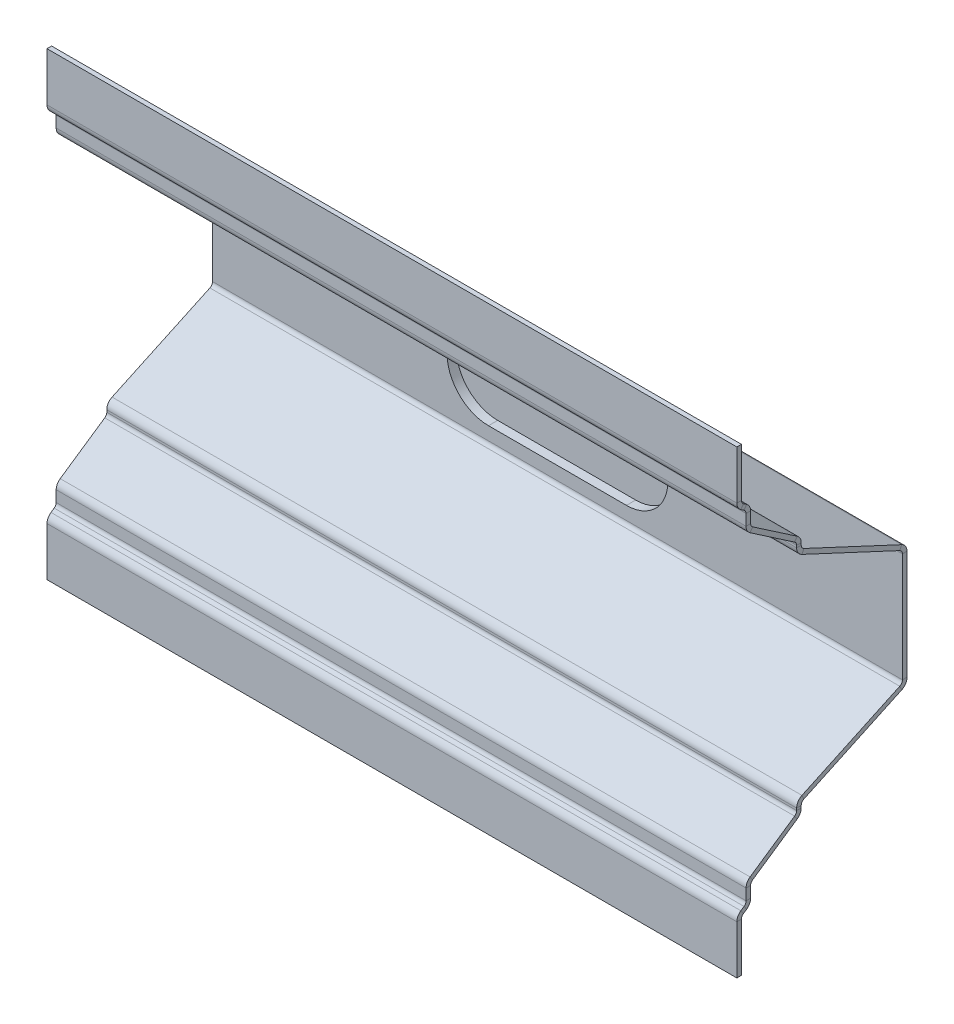
from build123d import *

# Parameters (mm, degrees)
BASE_FLANGE1_DEPTH         = 75
SHEET_START                = -1
SHEET_METAL_STAMP1_DEPTH   = 1
SHEET_START_2              = -3
SHEET_METAL_STAMP1_2_DEPTH = 1
SHEET_START_3              = -2
SHEET_METAL_STAMP1_3_DEPTH = 1


# Read off the part's stored shape, not the designer's step: Sheet Metal Stamp1
# Sheet-metal steps are written as plain solids
with BuildPart() as part:
    # Sketch1 → Base-Flange1 (new, symmetric)
    with BuildSketch(Plane.YZ):
        with BuildLine():
            Line((50, 36), (39.420641265, 36))
            ThreePointArc((39.420641265, 36), (38.486121949, 35.768240269), (37.768186579, 35.126673649))
            Line((37.768186579, 35.126673649), (37.297724892, 34.436663175))
            ThreePointArc((37.297724892, 34.436663175), (36.938757207, 34.115879865), (36.471497549, 34))
            Line((36.471497549, 34), (34.057004901, 34))
            ThreePointArc((34.057004901, 34), (33.122485586, 33.768240269), (32.404550215, 33.126673649))
            Line((32.404550215, 33.126673649), (25.797724892, 23.436663175))
            ThreePointArc((25.797724892, 23.436663175), (25.438757207, 23.115879865), (24.971497549, 23))
            Line((24.971497549, 23), (24.499216659, 23))
            ThreePointArc((24.499216659, 23), (23.424617442, 22.686782892), (22.686601085, 21.845236523))
            Line((22.686601085, 21.845236523), (12.769237526, 0.577381738))
            ThreePointArc((12.769237526, 0.577381738), (12.400229348, 0.156608554), (11.862929739, 0))
            Line((11.862929739, 0), (-11.862929739, 0))
            ThreePointArc((-11.862929739, 0), (-12.400229348, 0.156608554), (-12.769237526, 0.577381738))
            Line((-12.769237526, 0.577381738), (-22.686601085, 21.845236523))
            ThreePointArc((-22.686601085, 21.845236523), (-23.424617442, 22.686782892), (-24.499216659, 23))
            Line((-24.499216659, 23), (-24.971497549, 23))
            ThreePointArc((-24.971497549, 23), (-25.438757207, 23.115879865), (-25.797724892, 23.436663175))
            Line((-25.797724892, 23.436663175), (-32.404550215, 33.126673649))
            ThreePointArc((-32.404550215, 33.126673649), (-33.122485586, 33.768240269), (-34.057004901, 34))
            Line((-34.057004901, 34), (-36.471497549, 34))
            ThreePointArc((-36.471497549, 34), (-36.938757207, 34.115879865), (-37.297724892, 34.436663175))
            Line((-37.297724892, 34.436663175), (-37.768186579, 35.126673649))
            ThreePointArc((-37.768186579, 35.126673649), (-38.486121949, 35.768240269), (-39.420641265, 36))
            Line((-39.420641265, 36), (-50, 36))
            Line((-50, 36), (-50, 35))
            Line((-50, 35), (-39.420641265, 35))
            ThreePointArc((-39.420641265, 35), (-38.953381607, 34.884120135), (-38.594413922, 34.563336825))
            Line((-38.594413922, 34.563336825), (-38.123952235, 33.873326351))
            ThreePointArc((-38.123952235, 33.873326351), (-37.406016865, 33.231759731), (-36.471497549, 33))
            Line((-36.471497549, 33), (-34.057004901, 33))
            ThreePointArc((-34.057004901, 33), (-33.589745243, 32.884120135), (-33.230777558, 32.563336825))
            Line((-33.230777558, 32.563336825), (-26.623952235, 22.873326351))
            ThreePointArc((-26.623952235, 22.873326351), (-25.906016865, 22.231759731), (-24.971497549, 22))
            Line((-24.971497549, 22), (-24.499216659, 22))
            ThreePointArc((-24.499216659, 22), (-23.961917051, 21.843391446), (-23.592908872, 21.422618262))
            Line((-23.592908872, 21.422618262), (-13.675545313, 0.154763477))
            ThreePointArc((-13.675545313, 0.154763477), (-12.937528956, -0.686782892), (-11.862929739, -1))
            Line((-11.862929739, -1), (11.862929739, -1))
            ThreePointArc((11.862929739, -1), (12.937528956, -0.686782892), (13.675545313, 0.154763477))
            Line((13.675545313, 0.154763477), (23.592908872, 21.422618262))
            ThreePointArc((23.592908872, 21.422618262), (23.961917051, 21.843391446), (24.499216659, 22))
            Line((24.499216659, 22), (24.971497549, 22))
            ThreePointArc((24.971497549, 22), (25.906016865, 22.231759731), (26.623952235, 22.873326351))
            Line((26.623952235, 22.873326351), (33.230777558, 32.563336825))
            ThreePointArc((33.230777558, 32.563336825), (33.589745243, 32.884120135), (34.057004901, 33))
            Line((34.057004901, 33), (36.471497549, 33))
            ThreePointArc((36.471497549, 33), (37.406016865, 33.231759731), (38.123952235, 33.873326351))
            Line((38.123952235, 33.873326351), (38.594413922, 34.563336825))
            ThreePointArc((38.594413922, 34.563336825), (38.953381607, 34.884120135), (39.420641265, 35))
            Line((39.420641265, 35), (50, 35))
            Line((50, 35), (50, 36))
        make_face()
    extrude(amount=BASE_FLANGE1_DEPTH, both=True)

    # Sheet Metal Stamp1 outline → Sheet Metal Stamp1 (cut)
    with BuildSketch(Plane.XY.offset(SHEET_START)):
        with BuildLine():
            ThreePointArc((-15, 9), (-24, 0), (-15, -9))
            Line((-15, -9), (15, -9))
            ThreePointArc((15, -9), (24, 0), (15, 9))
            Line((15, 9), (-15, 9))
        make_face()
    extrude(amount=SHEET_METAL_STAMP1_DEPTH, mode=Mode.SUBTRACT)



with BuildPart() as body_2:
    # Sheet Metal Stamp1 2 outline → Sheet Metal Stamp1 2 (new body)
    with BuildSketch(Plane.XY.offset(SHEET_START_2)):
        with BuildLine():
            ThreePointArc((-15, 10), (-25, 0), (-15, -10))
            Line((-15, -10), (15, -10))
            ThreePointArc((15, -10), (25, 0), (15, 10))
            Line((15, 10), (-15, 10))
        make_face()
    extrude(amount=SHEET_METAL_STAMP1_2_DEPTH)


with BuildPart() as part_1:
    add(part.part)

    add(body_2.part)  # Sheet Metal Stamp1 3 merges body 2
    # Sheet Metal Stamp1 3 outline → Sheet Metal Stamp1 3 (add)
    with BuildSketch(Plane.XY.offset(SHEET_START_3)):
        with BuildLine():
            ThreePointArc((-15, 10), (-25, 0), (-15, -10))
            Line((-15, -10), (15, -10))
            ThreePointArc((15, -10), (25, 0), (15, 10))
            Line((15, 10), (-15, 10))
        make_face()
        with BuildLine():
            Line((15, -9), (-15, -9))
            ThreePointArc((-15, -9), (-24, 0), (-15, 9))
            Line((-15, 9), (15, 9))
            ThreePointArc((15, 9), (24, 0), (15, -9))
        make_face(mode=Mode.SUBTRACT)
    extrude(amount=SHEET_METAL_STAMP1_3_DEPTH)


solid = part_1.part
